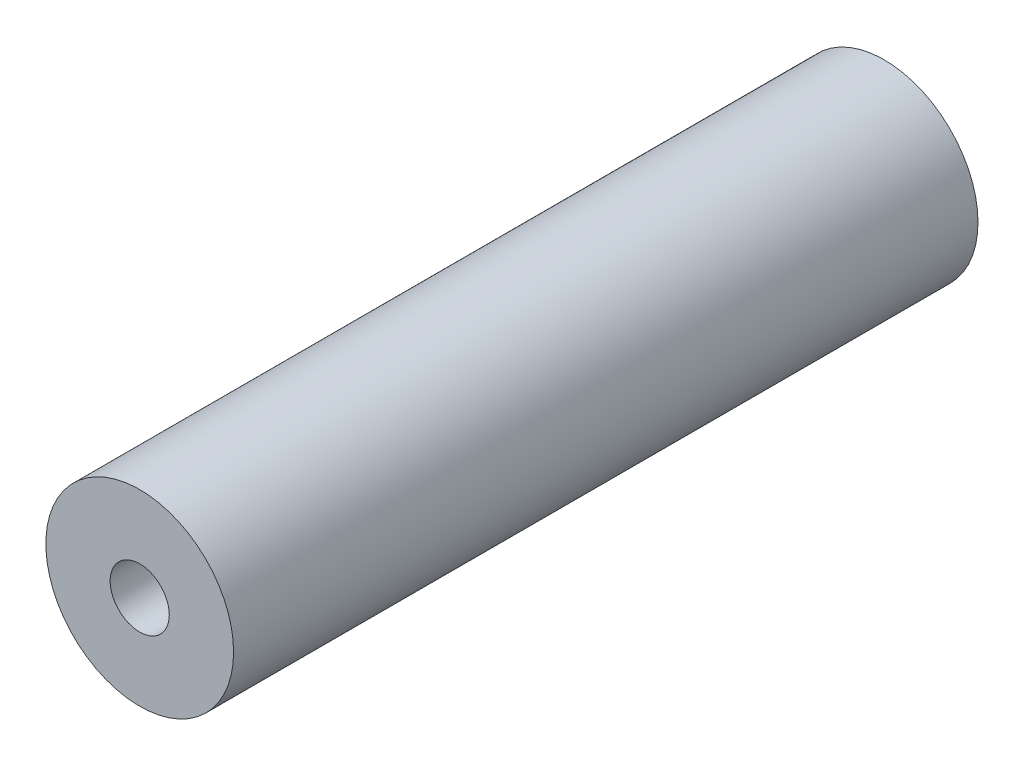
from build123d import *

# Parameters (mm, degrees)
SKETCH1_R           = 3.96875
BOSS_EXTRUDE1_DEPTH = 31.475
SKETCH3_R           = 1.25
CUT_EXTRUDE1_DEPTH  = 4.5
SKETCH4_R           = 1.352058412
CUT_EXTRUDE2_DEPTH  = 4.5


with BuildPart() as part:
    # Sketch1 → Boss-Extrude1 (new body)
    with BuildSketch(Plane.XY):
        Circle(SKETCH1_R)
    extrude(amount=BOSS_EXTRUDE1_DEPTH)

    # Sketch3 → Cut-Extrude1 (cut)
    with BuildSketch(Plane.XY.offset(31.475)):
        Circle(SKETCH3_R)
    extrude(amount=-CUT_EXTRUDE1_DEPTH, mode=Mode.SUBTRACT)

    # Sketch4 → Cut-Extrude2 (cut)
    with BuildSketch(Plane(origin=(0, 0, 0), x_dir=(-1, 0, 0), z_dir=(0, 0, -1))):
        Circle(SKETCH4_R)
    extrude(amount=-CUT_EXTRUDE2_DEPTH, mode=Mode.SUBTRACT)


solid = part.part
